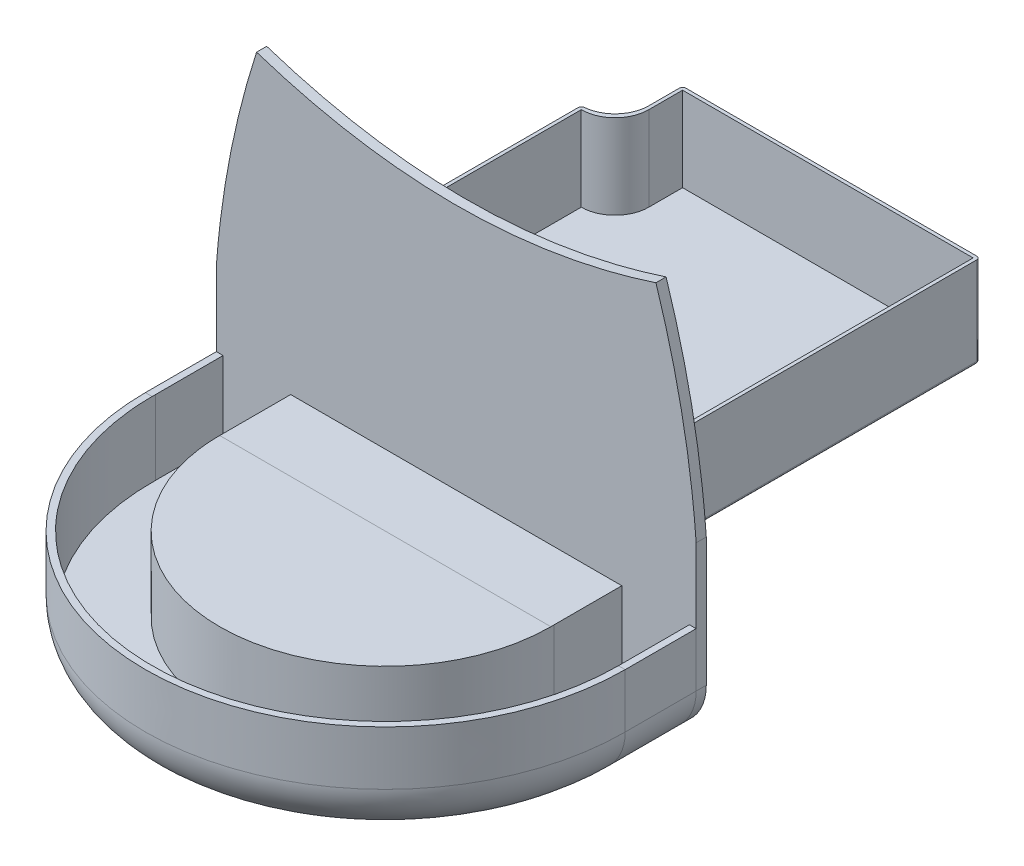
from build123d import *

# Parameters (mm, degrees)
BOSS_EXTRUDE2_DEPTH      = 3
SKETCH14_W               = 98
SKETCH14_H               = 27.00264841
BOSS_EXTRUDE4_DEPTH      = 113
CUT_EXTRUDE11_DEPTH      = 25
BOSS_EXTRUDE5_DEPTH      = 21
REVOLVE1_ANGLE           = 180
CUT_EXTRUDE15_DEPTH      = 1
CUT_EXTRUDE15_DEPTH_BACK = 22
CUT_EXTRUDE14_DEPTH      = 24
CUT_REVOLVE2_ANGLE       = 180
CUT_EXTRUDE16_DEPTH      = 30
FILLET1_R                = 1


# Read off the part's stored shape, not the designer's step: Boss-Extrude5
with BuildPart() as part:
    # Sketch1 → Boss-Extrude2 (new body)
    with BuildSketch(Plane.XY):
        with BuildLine():
            Line((0, 0), (-55.99287927, 0.000657501))
            ThreePointArc((-55.99287927, 0.000657501), (-66.60214284, 4.395231334), (-70.996716676, 15.00467109))
            Line((-70.996716676, 15.00467109), (-70.996716676, 53.003088443))
            add(Edge.make_bspline(
                [(-59.092437552, 113.703738569), (-65.518680916, 93.709690833), (-69.486773958, 73.476140791), (-70.996716676, 53.003088443)],
                knots=[0.003076868, 0.003076868, 0.003076868, 0.003076868, 0.620649816, 0.620649816, 0.620649816, 0.620649816], degree=3))
            add(Edge.make_bspline(
                [(-59.092437552, 113.703738569), (-39.394984135, 107.237929235), (0.002749603, 100.771350363), (39.400586429, 107.237584193), (59.100918302, 113.704587579)],
                knots=[0.007529078, 0.007529078, 0.007529078, 0.007529078, 0.499976084, 0.992492475, 0.992492475, 0.992492475, 0.992492475], degree=3))
            add(Edge.make_bspline(
                [(59.100918302, 113.704587579), (65.524413648, 93.710040003), (69.490811091, 73.476198601), (71.000110633, 53.003063374)],
                knots=[0.003067815, 0.003067815, 0.003067815, 0.003067815, 0.620645861, 0.620645861, 0.620645861, 0.620645861], degree=3))
            Line((71.000110633, 53.003063374), (71.000110633, 15.004646021))
            ThreePointArc((71.000110633, 15.004646021), (66.605957202, 4.396221214), (55.998086385, 0.002067804))
            Line((55.998086385, 0.002067804), (0, 0))
        make_face()
    extrude(amount=BOSS_EXTRUDE2_DEPTH)

    # Sketch14 → Boss-Extrude4 (add)
    with BuildSketch(Plane(origin=(0, 0, 0), x_dir=(-1, 0, 0), z_dir=(0, 0, -1))):
        with Locations((10.005711619, 38.506146673)):
            Rectangle(SKETCH14_W, SKETCH14_H)
    extrude(amount=BOSS_EXTRUDE4_DEPTH)

    # Sketch17 → Cut-Extrude11 (cut)
    with BuildSketch(Plane(origin=(0, 52.007470878, 0), x_dir=(1, 0, 0), z_dir=(0, 1, 0))):
        with BuildLine():
            Line((-48.015549057, 109.013130471), (-48.015549057, 101.996525982))
            ThreePointArc((-48.015549057, 101.996525982), (-50.942812726, 94.929486331), (-58.009852377, 92.002222662))
            Line((-58.009852377, 92.002222662), (-58.009852377, 89.000786475))
            Line((-58.009852377, 89.000786475), (-58.009852377, 0))
            Line((-58.009852377, 0), (37.981980496, 0))
            Line((37.981980496, 0), (37.981980496, 111.996441685))
            Line((37.981980496, 111.996441685), (-48.015549057, 111.996441685))
            Line((-48.015549057, 111.996441685), (-48.015549057, 109.013130471))
        make_face()
    extrude(amount=-CUT_EXTRUDE11_DEPTH, mode=Mode.SUBTRACT)

    # Boss-Extrude5 outline → Boss-Extrude5 (add)
    with BuildSketch(Plane.XY.offset(3)):
        with BuildLine():
            Line((70.996140169, 31.00236483), (-70.996716676, 31.00236483))
            Line((-70.996716676, 31.00236483), (-70.996716676, 15.00467109))
            ThreePointArc((-70.996716676, 15.00467109), (-66.602205131, 4.395293626), (-55.99287927, 0.0006575))
            Line((-55.99287927, 0.0006575), (55.993738248, 0.002091992))
            ThreePointArc((55.993738248, 0.002091992), (66.60204984, 4.396315904), (70.996140169, 15.004682829))
            Line((70.996140169, 15.004682829), (70.996140169, 31.00236483))
        make_face()
    extrude(amount=BOSS_EXTRUDE5_DEPTH)

    # Sketch23 → Revolve1 (revolve)
    with BuildSketch(Plane.XY.offset(24)):
        with BuildLine():
            Line((-0.000288253, 31.00236483), (0, 0))
            Line((0, 0), (-55.996899325, 0.000681852))
            ThreePointArc((-55.996899325, 0.000681852), (-66.603382969, 4.39414471), (-70.996716676, 15.000681851))
            Line((-70.996716676, 15.000681851), (-70.996716676, 15.00467109))
            Line((-70.996716676, 15.00467109), (-70.996716676, 31.00236483))
            Line((-70.996716676, 31.00236483), (-0.000288253, 31.00236483))
        make_face()
    revolve(axis=Axis((-0.000288253, 31.00236483, 24), (-9.297785566939823e-06, 0.9999999999567756, 0)), revolution_arc=REVOLVE1_ANGLE)

    # Sketch24 → Cut-Extrude15 (cut, two sides: drawn at the far end of the back side and taken through both)
    with BuildSketch(Plane(origin=(0, 31.00236483, 0), x_dir=(1, 0, 0), z_dir=(0, 1, 0)).offset(-CUT_EXTRUDE15_DEPTH_BACK)):
        with BuildLine():
            Line((68.999389406, -3), (48.994713166, -3))
            Line((48.994713166, -3), (48.994713166, -22.995821368))
            ThreePointArc((48.994713166, -22.995821368), (49.002483122, -23.497884055), (49.005108381, -24))
            Line((49.005108381, -24), (69.006686122, -24))
            ThreePointArc((69.006686122, -24), (69.004864469, -23.497897411), (68.999389406, -22.995821368))
            Line((68.999389406, -22.995821368), (68.999389406, -3))
        make_face()
        with BuildLine():
            Line((-49.004079193, -24), (-69.003422409, -24))
            ThreePointArc((-69.003422409, -24), (0.001631857, -93.004353523), (69.006686122, -24))
            Line((69.006686122, -24), (49.005108381, -24))
            ThreePointArc((49.005108381, -24), (34.65421123, -58.654415118), (0.001631857, -73.009744406))
            ThreePointArc((0.001631857, -73.009744406), (-34.65239206, -58.655205184), (-49.004079193, -24))
        make_face()
        with BuildLine():
            Line((-48.993683978, -3), (-68.996125693, -3))
            Line((-68.996125693, -3), (-68.996125693, -22.995821368))
            ThreePointArc((-68.996125693, -22.995821368), (-69.001600755, -23.497897411), (-69.003422409, -24))
            Line((-69.003422409, -24), (-49.004079193, -24))
            ThreePointArc((-49.004079193, -24), (-49.001453934, -23.497884055), (-48.993683978, -22.995821368))
            Line((-48.993683978, -22.995821368), (-48.993683978, -3))
        make_face()
    extrude(amount=CUT_EXTRUDE15_DEPTH + CUT_EXTRUDE15_DEPTH_BACK, mode=Mode.SUBTRACT)

    # Sketch21 → Cut-Extrude14 (cut)
    with BuildSketch(Plane(origin=(0, 0, 0), x_dir=(-1, 0, 0), z_dir=(0, 0, -1))):
        Polygon((-46.994052442, 0.001735318), (-46.994052442, 25.004822468), (0, 25.004822468), (46.999021514, 25.004822468), (46.999021514, 0.000551889), (0, 0), align=None)
    extrude(amount=-CUT_EXTRUDE14_DEPTH, mode=Mode.SUBTRACT)

    # Sketch26 → Cut-Revolve2 (revolve, cut)
    with BuildSketch(Plane(origin=(0, 0, 24), x_dir=(-1, 0, 0), z_dir=(0, 0, -1))):
        Polygon((-46.994052442, 25.004822468), (0.002484536, 25.004822468), (0, -0.975536805), (-46.994052442, -0.975536805), (-46.994052442, 0.001735318), align=None)
    revolve(axis=Axis((0, -0.975536805, 24), (9.56313097373021e-05, -0.9999999954273263, 0)), revolution_arc=CUT_REVOLVE2_ANGLE, mode=Mode.SUBTRACT)

    # Sketch27 → Cut-Extrude16 (cut)
    with BuildSketch(Plane(origin=(0, 52.007470878, 0), x_dir=(1, 0, 0), z_dir=(0, 1, 0))):
        with BuildLine():
            Line((-49.010012163, 113), (-49.010012163, 102.994608886))
            ThreePointArc((-49.010012163, 102.994608886), (-66.073738487, 95.926582018), (-59.005711619, 112.990308342))
            Line((-59.005711619, 112.990308342), (-59.005711619, 113.493786648))
            Line((-59.005711619, 113.493786648), (-49.010012163, 113.493786648))
            Line((-49.010012163, 113.493786648), (-49.010012163, 113))
        make_face()
    extrude(amount=-CUT_EXTRUDE16_DEPTH, mode=Mode.SUBTRACT)

    # Fillet1
    fillet1_edges = [part.edges().sort_by_distance(p)[0] for p in [
        (-49.010012163, 38.506146673, -113),
        (-59.005711619, 25.004822468, -46.499454715),
        (-59.005711619, 38.506146673, -92.99890943),
        (38.994288381, 25.004822468, -56.5),
        (38.994288381, 38.506146673, -113),
        (-5.007861891, 25.004822468, -113),
    ]]
    fillet(fillet1_edges, radius=FILLET1_R)


solid = part.part
